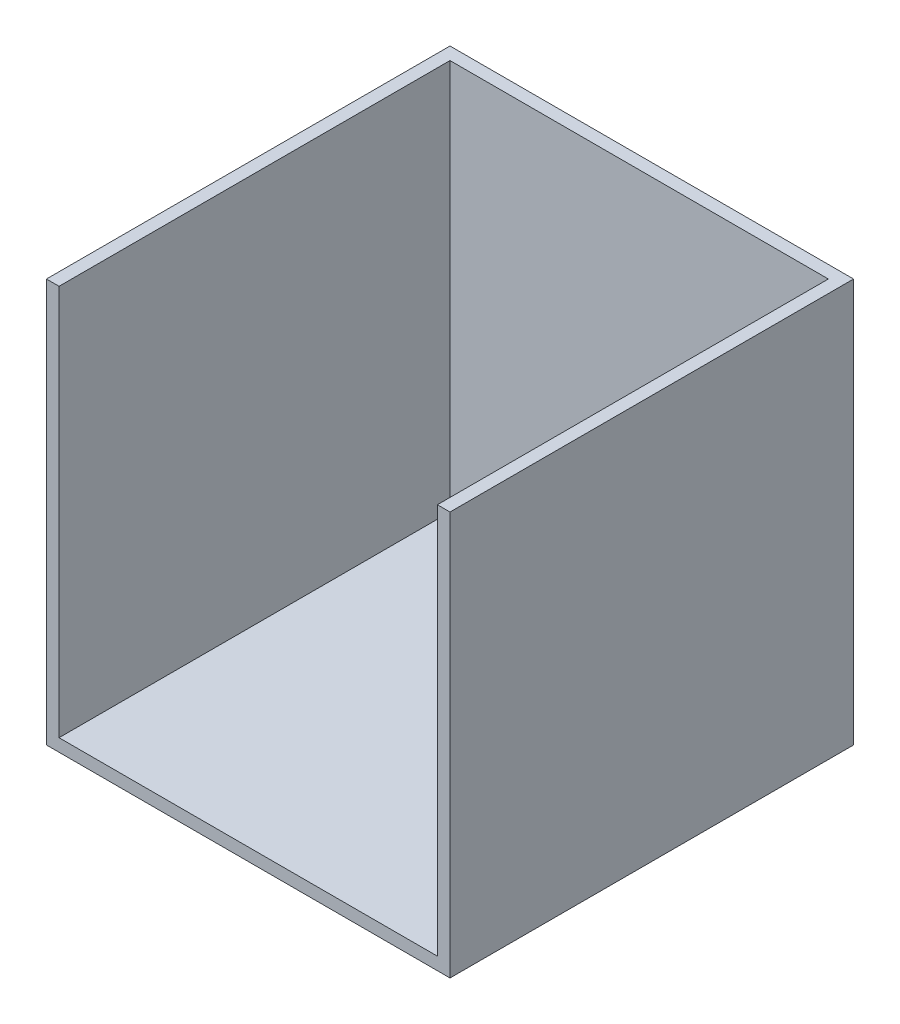
from build123d import *

# Parameters (mm, degrees)
SKETCH1_W           = 304.8
SKETCH1_H           = 304.8
BOSS_EXTRUDE1_DEPTH = 304.8
SHELL1_T            = -9.525


with BuildPart() as part:
    # Sketch1 → Boss-Extrude1 (new body)
    with BuildSketch(Plane.XY):
        Rectangle(SKETCH1_W, SKETCH1_H)
    extrude(amount=BOSS_EXTRUDE1_DEPTH)

    # Shell1
    shell1_openings = [part.faces().sort_by_distance(p)[0] for p in [
        (0, 0, 304.8),
        (0, 152.4, 152.4),
    ]]
    offset(amount=SHELL1_T, openings=shell1_openings, kind=Kind.INTERSECTION)


solid = part.part
